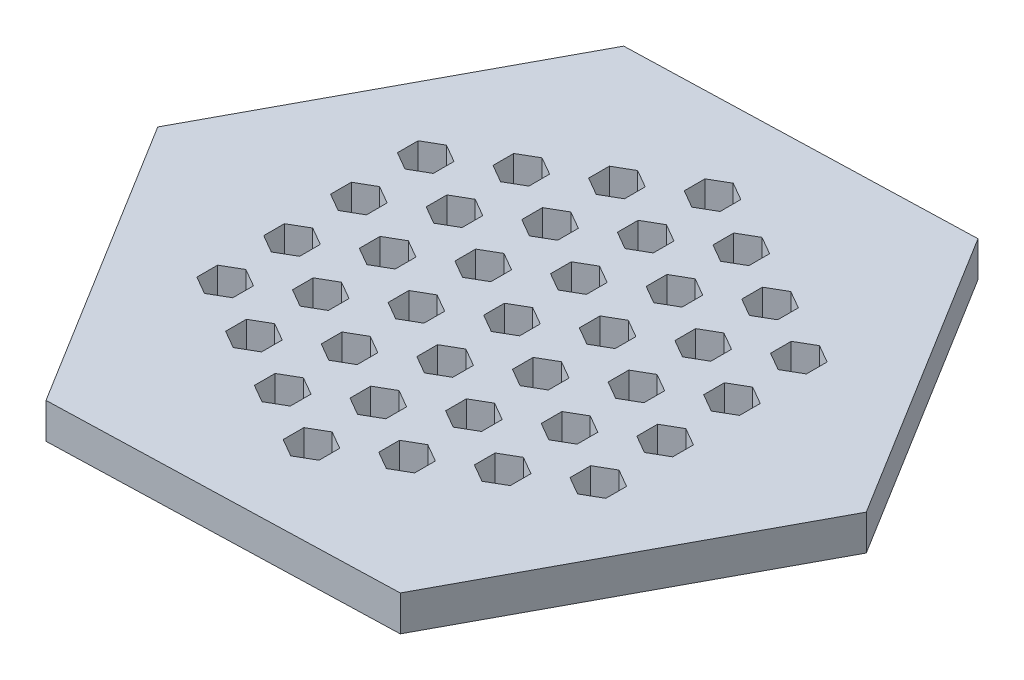
from build123d import *

# Parameters (mm, degrees)
BOSS_EXTRUDE1_DEPTH = 5
CUT_EXTRUDE2_DEPTH  = 5
FILL_PATTERN2_DEPTH = 5


# Read off the part's stored shape, not the designer's step: Fill Pattern2
with BuildPart() as part:
    # Sketch1 → Boss-Extrude1 (new body)
    with BuildSketch(Plane(origin=(0, 0, 0), x_dir=(1, 0, 0), z_dir=(0, 1, 0))):
        Polygon((-25.526591669, 41.290534689), (-48.521947811, -1.461409513), (-22.995356142, -42.751944202), (25.526591669, -41.290534689), (48.521947811, 1.461409513), (22.995356142, 42.751944202), align=None)
    extrude(amount=BOSS_EXTRUDE1_DEPTH)

    # Sketch2 → Cut-Extrude2 (cut)
    with BuildSketch(Plane(origin=(0, 5, 0), x_dir=(1, 0, 0), z_dir=(0, 1, 0))):
        Polygon((0, 2.921404047), (-2.530010119, 1.460702024), (-2.530010119, -1.460702024), (0, -2.921404047), (2.530010119, -1.460702024), (2.530010119, 1.460702024), align=None)
    extrude(amount=-CUT_EXTRUDE2_DEPTH, mode=Mode.SUBTRACT)

    # Fill Pattern2 outline → Fill Pattern2 (cut)
    with BuildSketch(Plane(origin=(0, 0, 0), x_dir=(1, 0, 0), z_dir=(0, 1, 0))):
        Polygon((-23.407097013, 12.302018341), (-23.407097013, 15.223422388), (-25.937107133, 16.684124412), (-28.467117252, 15.223422388), (-28.467117252, 12.302018341), (-25.937107133, 10.841316318), align=None)
        Polygon((28.467117252, -15.223422388), (28.467117252, -12.302018341), (25.937107133, -10.841316318), (23.407097013, -12.302018341), (23.407097013, -15.223422388), (25.937107133, -16.684124412), align=None)
        Polygon((20.17131091, -20.417033553), (20.17131091, -17.495629506), (17.64130079, -16.034927483), (15.111290671, -17.495629506), (15.111290671, -20.417033553), (17.64130079, -21.877735577), align=None)
        Polygon((11.875504567, -25.610644718), (11.875504567, -22.689240671), (9.345494448, -21.228538648), (6.815484329, -22.689240671), (6.815484329, -25.610644718), (9.345494448, -27.071346742), align=None)
        Polygon((-22.707304943, -7.260350899), (-22.707304943, -4.338946852), (-25.237315062, -2.878244828), (-27.767325182, -4.338946852), (-27.767325182, -7.260350899), (-25.237315062, -8.721052923), align=None)
        Polygon((-14.411498601, -2.066739734), (-14.411498601, 0.854664313), (-16.94150872, 2.315366337), (-19.47151884, 0.854664313), (-19.47151884, -2.066739734), (-16.94150872, -3.527441757), align=None)
        Polygon((-6.115692258, 3.126871431), (-6.115692258, 6.048275478), (-8.645702378, 7.508977502), (-11.175712497, 6.048275478), (-11.175712497, 3.126871431), (-8.645702378, 1.666169408), align=None)
        Polygon((2.180114084, 8.320482596), (2.180114084, 11.241886644), (-0.349896035, 12.702588667), (-2.879906155, 11.241886644), (-2.879906155, 8.320482596), (-0.349896035, 6.859780573), align=None)
        Polygon((10.475920427, 13.514093762), (10.475920427, 16.435497809), (7.945910307, 17.896199832), (5.415900188, 16.435497809), (5.415900188, 13.514093762), (7.945910307, 12.053391738), align=None)
        Polygon((18.771726769, 18.707704927), (18.771726769, 21.629108974), (16.24171665, 23.089810997), (13.71170653, 21.629108974), (13.71170653, 18.707704927), (16.24171665, 17.247002903), align=None)
        Polygon((-22.357408908, -17.041535519), (-22.357408908, -14.120131472), (-24.887419027, -12.659429448), (-27.417429147, -14.120131472), (-27.417429147, -17.041535519), (-24.887419027, -18.502237543), align=None)
        Polygon((-14.061602565, -11.847924354), (-14.061602565, -8.926520307), (-16.591612685, -7.465818283), (-19.121622804, -8.926520307), (-19.121622804, -11.847924354), (-16.591612685, -13.308626377), align=None)
        Polygon((-23.057200978, 2.520833721), (-23.057200978, 5.442237768), (-25.587211098, 6.902939792), (-28.117221217, 5.442237768), (-28.117221217, 2.520833721), (-25.587211098, 1.060131697), align=None)
        Polygon((1.480322014, 27.882851836), (1.480322014, 30.804255884), (-1.049688106, 32.264957907), (-3.579698225, 30.804255884), (-3.579698225, 27.882851836), (-1.049688106, 26.422149813), align=None)
        Polygon((-6.815484329, 22.689240671), (-6.815484329, 25.610644718), (-9.345494448, 27.071346742), (-11.875504567, 25.610644718), (-11.875504567, 22.689240671), (-9.345494448, 21.228538648), align=None)
        Polygon((-15.111290671, 17.495629506), (-15.111290671, 20.417033553), (-17.64130079, 21.877735577), (-20.17131091, 20.417033553), (-20.17131091, 17.495629506), (-17.64130079, 16.034927483), align=None)
        Polygon((-14.761394636, 7.714444886), (-14.761394636, 10.635848933), (-17.291404755, 12.096550957), (-19.821414875, 10.635848933), (-19.821414875, 7.714444886), (-17.291404755, 6.253742863), align=None)
        Polygon((-6.465588293, 12.908056051), (-6.465588293, 15.829460098), (-8.995598413, 17.290162122), (-11.525608532, 15.829460098), (-11.525608532, 12.908056051), (-8.995598413, 11.447354028), align=None)
        Polygon((1.830218049, 18.101667216), (1.830218049, 21.023071264), (-0.69979207, 22.483773287), (-3.22980219, 21.023071264), (-3.22980219, 18.101667216), (-0.69979207, 16.640965193), align=None)
        Polygon((10.126024392, 23.295278382), (10.126024392, 26.216682429), (7.596014272, 27.677384452), (5.066004153, 26.216682429), (5.066004153, 23.295278382), (7.596014272, 21.834576358), align=None)
        Polygon((19.47151884, -0.854664313), (19.47151884, 2.066739734), (16.94150872, 3.527441757), (14.411498601, 2.066739734), (14.411498601, -0.854664313), (16.94150872, -2.315366337), align=None)
        Polygon((27.767325182, 4.338946852), (27.767325182, 7.260350899), (25.237315062, 8.721052923), (22.707304943, 7.260350899), (22.707304943, 4.338946852), (25.237315062, 2.878244828), align=None)
        Polygon((-5.066004153, -26.216682429), (-5.066004153, -23.295278382), (-7.596014272, -21.834576358), (-10.126024392, -23.295278382), (-10.126024392, -26.216682429), (-7.596014272, -27.677384452), align=None)
        Polygon((3.22980219, -21.023071264), (3.22980219, -18.101667216), (0.69979207, -16.640965193), (-1.830218049, -18.101667216), (-1.830218049, -21.023071264), (0.69979207, -22.483773287), align=None)
        Polygon((3.579698225, -30.804255884), (3.579698225, -27.882851836), (1.049688106, -26.422149813), (-1.480322014, -27.882851836), (-1.480322014, -30.804255884), (1.049688106, -32.264957907), align=None)
        Polygon((28.117221217, -5.442237768), (28.117221217, -2.520833721), (25.587211098, -1.060131697), (23.057200978, -2.520833721), (23.057200978, -5.442237768), (25.587211098, -6.902939792), align=None)
        Polygon((19.821414875, -10.635848933), (19.821414875, -7.714444886), (17.291404755, -6.253742863), (14.761394636, -7.714444886), (14.761394636, -10.635848933), (17.291404755, -12.096550957), align=None)
        Polygon((11.525608532, -15.829460098), (11.525608532, -12.908056051), (8.995598413, -11.447354028), (6.465588293, -12.908056051), (6.465588293, -15.829460098), (8.995598413, -17.290162122), align=None)
        Polygon((-5.765796223, -6.654313189), (-5.765796223, -3.732909142), (-8.295806342, -2.272207118), (-10.825816462, -3.732909142), (-10.825816462, -6.654313189), (-8.295806342, -8.115015212), align=None)
        Polygon((10.825816462, 3.732909142), (10.825816462, 6.654313189), (8.295806342, 8.115015212), (5.765796223, 6.654313189), (5.765796223, 3.732909142), (8.295806342, 2.272207118), align=None)
        Polygon((19.121622804, 8.926520307), (19.121622804, 11.847924354), (16.591612685, 13.308626377), (14.061602565, 11.847924354), (14.061602565, 8.926520307), (16.591612685, 7.465818283), align=None)
        Polygon((27.417429147, 14.120131472), (27.417429147, 17.041535519), (24.887419027, 18.502237543), (22.357408908, 17.041535519), (22.357408908, 14.120131472), (24.887419027, 12.659429448), align=None)
        Polygon((-13.71170653, -21.629108974), (-13.71170653, -18.707704927), (-16.24171665, -17.247002903), (-18.771726769, -18.707704927), (-18.771726769, -21.629108974), (-16.24171665, -23.089810997), align=None)
        Polygon((-5.415900188, -16.435497809), (-5.415900188, -13.514093762), (-7.945910307, -12.053391738), (-10.475920427, -13.514093762), (-10.475920427, -16.435497809), (-7.945910307, -17.896199832), align=None)
        Polygon((2.879906155, -11.241886644), (2.879906155, -8.320482596), (0.349896035, -6.859780573), (-2.180114084, -8.320482596), (-2.180114084, -11.241886644), (0.349896035, -12.702588667), align=None)
        Polygon((11.175712497, -6.048275478), (11.175712497, -3.126871431), (8.645702378, -1.666169408), (6.115692258, -3.126871431), (6.115692258, -6.048275478), (8.645702378, -7.508977502), align=None)
    extrude(amount=FILL_PATTERN2_DEPTH, mode=Mode.SUBTRACT)


solid = part.part
